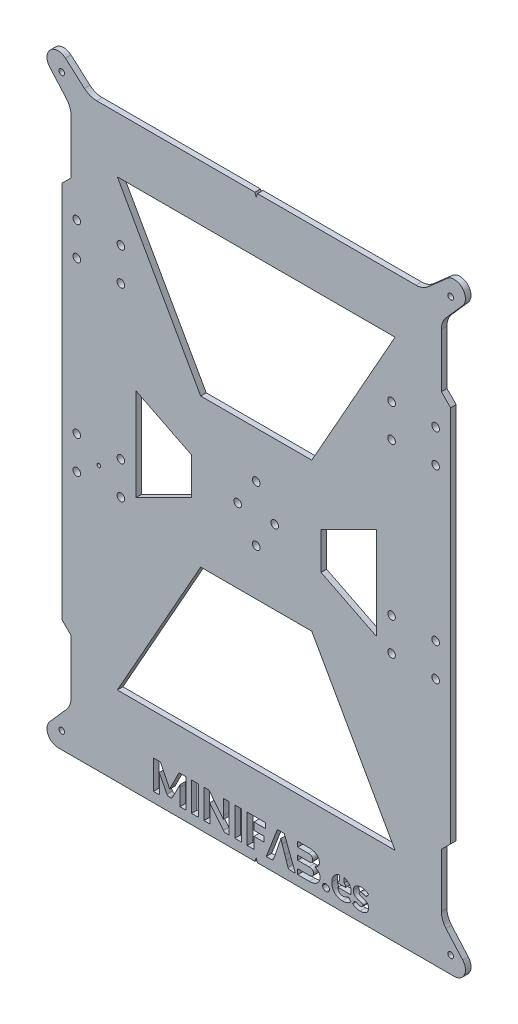
from build123d import *

# Parameters (mm, degrees)
MODEL_R                 = 2.05
MODEL_R_2               = 1.55
MODEL_R_3               = 1
MODEL_W                 = 3.629865987
MODEL_H                 = 15.619236111
MODEL_W_2               = 3.629865988
SALIENTE_EXTRUIR1_DEPTH = 3


with BuildPart() as part:
    # Model → Saliente-Extruir1 (new body)
    with BuildSketch(Plane.XY):
        with BuildLine():
            Line((-102.502115315, -142.835304077), (-111.498730811, -153.029934372))
            ThreePointArc((-111.498730811, -153.029934372), (-112.469021565, -159.467752645), (-107, -163))
            Line((-107, -163), (-0.700702433, -163))
            Line((-0.700702433, -163), (0, -160.996661892))
            Line((0, -160.996661892), (0.699463472, -163))
            Line((0.699463472, -163), (107, -163))
            ThreePointArc((107, -163), (112.469021565, -159.467752645), (111.498730811, -153.029934372))
            Line((111.498730811, -153.029934372), (102.502115315, -142.835304077))
            ThreePointArc((102.502115315, -142.835304077), (100.646421892, -139.755557374), (100, -136.21852803))
            Line((100, -136.21852803), (100, -107))
            Line((100, -107), (105, -102))
            Line((105, -102), (105, 102))
            Line((105, 102), (100, 107))
            Line((100, 107), (100, 136.21852803))
            ThreePointArc((100, 136.21852803), (100.646421892, 139.755557374), (102.502115315, 142.835304077))
            Line((102.502115315, 142.835304077), (111.498730811, 153.029934372))
            ThreePointArc((111.498730811, 153.029934372), (111.242640687, 161.242640687), (103.029934372, 161.498730811))
            Line((103.029934372, 161.498730811), (92.835304077, 152.502115315))
            ThreePointArc((92.835304077, 152.502115315), (89.755557374, 150.646421892), (86.21852803, 150))
            Line((86.21852803, 150), (0.701283747, 150))
            Line((0.701283747, 150), (0, 148))
            Line((0, 148), (-0.697387345, 150))
            Line((-0.697387345, 150), (-86.21852803, 150))
            ThreePointArc((-86.21852803, 150), (-89.755557374, 150.646421892), (-92.835304077, 152.502115315))
            Line((-92.835304077, 152.502115315), (-103.029934372, 161.498730811))
            ThreePointArc((-103.029934372, 161.498730811), (-111.242640687, 161.242640687), (-111.498730811, 153.029934372))
            Line((-111.498730811, 153.029934372), (-102.502115315, 142.835304077))
            ThreePointArc((-102.502115315, 142.835304077), (-100.646421892, 139.755557374), (-100, 136.21852803))
            Line((-100, 136.21852803), (-100, 107))
            Line((-100, 107), (-105, 102))
            Line((-105, 102), (-105, -102))
            Line((-105, -102), (-100, -107))
            Line((-100, -107), (-100, -136.21852803))
            ThreePointArc((-100, -136.21852803), (-100.646421892, -139.755557374), (-102.502115315, -142.835304077))
        make_face()
        with Locations((-96.9, 88.9)):
            Circle(MODEL_R, mode=Mode.SUBTRACT)
        with Locations((-73.1, 88.9)):
            Circle(MODEL_R, mode=Mode.SUBTRACT)
        with Locations((-73.1, 71.1)):
            Circle(MODEL_R, mode=Mode.SUBTRACT)
        with Locations((-96.9, 71.1)):
            Circle(MODEL_R, mode=Mode.SUBTRACT)
        with Locations((73.1, 88.9)):
            Circle(MODEL_R, mode=Mode.SUBTRACT)
        with Locations((96.9, 88.9)):
            Circle(MODEL_R, mode=Mode.SUBTRACT)
        with Locations((96.9, 71.1)):
            Circle(MODEL_R, mode=Mode.SUBTRACT)
        with Locations((73.1, 71.1)):
            Circle(MODEL_R, mode=Mode.SUBTRACT)
        with Locations((73.1, -11.095834068)):
            Circle(MODEL_R, mode=Mode.SUBTRACT)
        with Locations((96.9, -11.095834068)):
            Circle(MODEL_R, mode=Mode.SUBTRACT)
        with Locations((96.9, -28.895834068)):
            Circle(MODEL_R, mode=Mode.SUBTRACT)
        with Locations((73.1, -28.895834068)):
            Circle(MODEL_R, mode=Mode.SUBTRACT)
        with Locations((-96.9, -11.095834068)):
            Circle(MODEL_R, mode=Mode.SUBTRACT)
        with Locations((-73.1, -11.095834068)):
            Circle(MODEL_R, mode=Mode.SUBTRACT)
        with Locations((-73.1, -28.895834068)):
            Circle(MODEL_R, mode=Mode.SUBTRACT)
        with Locations((-96.9, -28.895834068)):
            Circle(MODEL_R, mode=Mode.SUBTRACT)
        with Locations((-10, 0)):
            Circle(MODEL_R, mode=Mode.SUBTRACT)
        with Locations((0, -15)):
            Circle(MODEL_R, mode=Mode.SUBTRACT)
        with Locations((10, 0)):
            Circle(MODEL_R, mode=Mode.SUBTRACT)
        with Locations((0, 15)):
            Circle(MODEL_R, mode=Mode.SUBTRACT)
        with Locations((-105, 154)):
            Circle(MODEL_R_2, mode=Mode.SUBTRACT)
        with Locations((105, 154)):
            Circle(MODEL_R_2, mode=Mode.SUBTRACT)
        with Locations((105, -154)):
            Circle(MODEL_R_2, mode=Mode.SUBTRACT)
        with Locations((-105, -154)):
            Circle(MODEL_R_2, mode=Mode.SUBTRACT)
        with Locations((-85, -19.995834068)):
            Circle(MODEL_R_3, mode=Mode.SUBTRACT)
        with BuildLine():
            Line((52.095027022, -156.41208278), (52.861160439, -155.160937482))
            add(Edge.make_bspline(
                [(52.861160439, -155.160937482), (52.907509966, -155.092418808), (52.997477945, -154.959418821), (53.185963701, -154.803141359), (53.423267883, -154.700400467), (53.600365736, -154.692510271), (53.695257304, -154.688282592)],
                knots=[0, 0, 0, 0, 0.245290843, 0.476128294, 0.719302032, 1, 1, 1, 1], degree=3))
            add(Edge.make_bspline(
                [(53.695257304, -154.688282592), (53.787088352, -154.693043404), (53.966912235, -154.702366044), (54.21796444, -154.812878477), (54.456999334, -154.950937893), (54.715280368, -155.097827414), (55.009108198, -155.236317332), (55.280571829, -155.349141253), (55.528920408, -155.422099819), (55.744003449, -155.462405293), (55.983002658, -155.481896061), (56.150151944, -155.486162753), (56.237708119, -155.488397733)],
                knots=[0, 0, 0, 0, 0.101218808, 0.198207026, 0.299998441, 0.408449622, 0.527553892, 0.660405958, 0.734188953, 0.814433565, 0.902796551, 1, 1, 1, 1], degree=3))
            add(Edge.make_bspline(
                [(56.237708119, -155.488397733), (56.356410443, -155.485846588), (56.574977321, -155.48114916), (56.876071404, -155.423093263), (57.119240443, -155.327949342), (57.314137005, -155.20601289), (57.454197585, -155.054947272), (57.552257465, -154.890093726), (57.614333338, -154.716297931), (57.621334472, -154.596079138), (57.624780313, -154.536909457)],
                knots=[0, 0, 0, 0, 0.188682589, 0.347421708, 0.484947511, 0.602199732, 0.710004379, 0.8091973, 0.9060901, 1, 1, 1, 1], degree=3))
            add(Edge.make_bspline(
                [(57.624780313, -154.536909457), (57.621482629, -154.484157312), (57.615108815, -154.382197149), (57.575117823, -154.235725982), (57.50199102, -154.106103883), (57.36128645, -153.954441298), (57.13562643, -153.783211356), (56.800832225, -153.624284121), (56.41224281, -153.476310395), (55.976542587, -153.345061986), (55.51175766, -153.205847702), (55.035193229, -153.048988326), (54.559828883, -152.859086985), (54.090517884, -152.646518294), (53.64711444, -152.380507075), (53.320740417, -152.099722678), (53.087751731, -151.845054324), (52.933308839, -151.629338826), (52.794807748, -151.394758141), (52.671669381, -151.139901752), (52.576657444, -150.858716387), (52.504524301, -150.551822021), (52.466347114, -150.216001771), (52.459841643, -149.983443484), (52.456468997, -149.862877765)],
                knots=[0, 0, 0, 0, 0.020826651, 0.040254073, 0.059360004, 0.078935649, 0.121531971, 0.17024273, 0.224661673, 0.28558902, 0.34974246, 0.416187632, 0.483507056, 0.551689521, 0.619371103, 0.686816769, 0.72077146, 0.75540288, 0.791298975, 0.828202462, 0.866889025, 0.90819589, 0.952405787, 1, 1, 1, 1], degree=3))
            add(Edge.make_bspline(
                [(52.456468997, -149.862877765), (52.460492112, -149.747397021), (52.468431386, -149.519505647), (52.517957846, -149.181333208), (52.606596919, -148.854291935), (52.722084904, -148.533616648), (52.87816878, -148.22942513), (53.06246008, -147.938356159), (53.288664772, -147.673586603), (53.542331366, -147.422896425), (53.835393057, -147.19868684), (54.160313751, -146.992243233), (54.523763196, -146.818917084), (54.918629928, -146.665986746), (55.348029509, -146.541592128), (55.813884728, -146.457614372), (56.312660992, -146.404031895), (56.656670418, -146.397182195), (56.833932915, -146.393652655)],
                knots=[0, 0, 0, 0, 0.055262239, 0.109055304, 0.163073539, 0.217165875, 0.271811873, 0.326342247, 0.381604486, 0.438048939, 0.496689275, 0.557794795, 0.621918591, 0.688988214, 0.760253721, 0.835436254, 0.915202962, 1, 1, 1, 1], degree=3))
            add(Edge.make_bspline(
                [(56.833932915, -146.393652655), (57.030965746, -146.398622916), (57.41963035, -146.408427191), (57.98868694, -146.497166197), (58.531706757, -146.622676315), (59.038931463, -146.801586748), (59.510543472, -147.011870326), (59.936196139, -147.264765225), (60.322963817, -147.538804587), (60.546381409, -147.751261153), (60.655332256, -147.854866793)],
                knots=[0, 0, 0, 0, 0.140830454, 0.277800468, 0.411066954, 0.538943015, 0.661888089, 0.779742, 0.892589946, 1, 1, 1, 1], degree=3))
            Line((60.655332256, -147.854866793), (59.907734325, -149.022602404))
            add(Edge.make_bspline(
                [(59.907734325, -149.022602404), (59.867180961, -149.082374658), (59.79206122, -149.193094846), (59.644245507, -149.321032103), (59.46367139, -149.386117508), (59.336740945, -149.392797444), (59.268260062, -149.39640137)],
                knots=[0, 0, 0, 0, 0.27702591, 0.513153834, 0.737339174, 1, 1, 1, 1], degree=3))
            add(Edge.make_bspline(
                [(59.268260062, -149.39640137), (59.189341546, -149.391713052), (59.028117745, -149.382135218), (58.790844894, -149.298353294), (58.549238458, -149.188947778), (58.284662805, -149.076643302), (57.99368379, -148.963533836), (57.668305918, -148.860810087), (57.300403204, -148.775870901), (57.037358104, -148.769533095), (56.898807116, -148.766194849)],
                knots=[0, 0, 0, 0, 0.095523231, 0.195145821, 0.302651249, 0.418035853, 0.543855996, 0.681433164, 0.832204629, 1, 1, 1, 1], degree=3))
            add(Edge.make_bspline(
                [(56.898807116, -148.766194849), (56.799810412, -148.769154533), (56.613115617, -148.774736108), (56.349099043, -148.815990719), (56.122215307, -148.892374014), (55.931437996, -148.998298896), (55.780422106, -149.13162692), (55.670438268, -149.291262798), (55.607259783, -149.476354571), (55.5992676, -149.607024102), (55.595144608, -149.674433658)],
                knots=[0, 0, 0, 0, 0.166013321, 0.313079344, 0.446335679, 0.565433653, 0.676725774, 0.78114646, 0.887098241, 1, 1, 1, 1], degree=3))
            add(Edge.make_bspline(
                [(55.595144608, -149.674433658), (55.59664219, -149.724315156), (55.599545797, -149.821028595), (55.647883369, -149.957403382), (55.714180504, -150.08366501), (55.852625747, -150.232828963), (56.079284207, -150.394278729), (56.408807229, -150.558858631), (56.795198378, -150.704599718), (57.227653587, -150.843228366), (57.687723387, -150.985880589), (58.160267565, -151.14975483), (58.634346501, -151.331217455), (59.096721773, -151.545188159), (59.535139284, -151.796165194), (59.860404016, -152.057503293), (60.095157385, -152.291393519), (60.247312763, -152.491289616), (60.389023172, -152.703770786), (60.505495027, -152.937585214), (60.605016239, -153.19071011), (60.669161948, -153.469694604), (60.715720213, -153.771283031), (60.718676728, -153.980643477), (60.720206457, -154.088968548)],
                knots=[0, 0, 0, 0, 0.020281241, 0.039322567, 0.058544603, 0.078231425, 0.12185398, 0.171570131, 0.228495125, 0.290544934, 0.357261034, 0.425439985, 0.495031948, 0.56473083, 0.633623771, 0.701027274, 0.734673084, 0.768870308, 0.803556567, 0.838958708, 0.875477567, 0.914489313, 0.955755964, 1, 1, 1, 1], degree=3))
            add(Edge.make_bspline(
                [(60.720206457, -154.088968548), (60.71660975, -154.223003344), (60.709495357, -154.488128164), (60.654060247, -154.877992372), (60.556229095, -155.250759141), (60.42719847, -155.607633647), (60.26184975, -155.945060467), (60.0533761, -156.257086475), (59.813629618, -156.548492525), (59.533179574, -156.812878296), (59.215436996, -157.045717595), (58.8678642, -157.260638899), (58.479324457, -157.434925338), (58.062028595, -157.592781481), (57.609379799, -157.711274008), (57.123933207, -157.797612873), (56.605450373, -157.850252979), (56.248130024, -157.8573149), (56.06471025, -157.860939927)],
                knots=[0, 0, 0, 0, 0.059485075, 0.117663251, 0.174314871, 0.230276316, 0.28587819, 0.340645236, 0.396477726, 0.453062923, 0.511205175, 0.571096297, 0.63408369, 0.699887322, 0.768962516, 0.841408182, 0.918591607, 1, 1, 1, 1], degree=3))
            add(Edge.make_bspline(
                [(56.06471025, -157.860939927), (55.87595853, -157.855588608), (55.496642064, -157.84483457), (54.932274669, -157.757376771), (54.378424414, -157.62417346), (53.841501884, -157.452896095), (53.333935545, -157.240930649), (52.867005735, -156.996278733), (52.449602472, -156.72532334), (52.210173144, -156.513805659), (52.095027022, -156.41208278)],
                knots=[0, 0, 0, 0, 0.131193657, 0.263647474, 0.396161276, 0.527045832, 0.655106904, 0.778099117, 0.893283641, 1, 1, 1, 1], degree=3))
        make_face(mode=Mode.SUBTRACT)
        with BuildLine():
            Line((5.407227309, -157.663228077), (11.428170976, -142.043991966))
            Line((11.428170976, -142.043991966), (15.122911164, -142.043991966))
            Line((15.122911164, -142.043991966), (21.143854831, -157.663228077))
            Line((21.143854831, -157.663228077), (18.348085709, -157.663228077))
            add(Edge.make_bspline(
                [(18.348085709, -157.663228077), (18.273802919, -157.659905766), (18.131295521, -157.653532097), (17.926826548, -157.615032697), (17.746081904, -157.542162091), (17.585016004, -157.446415564), (17.451247247, -157.323229604), (17.330281041, -157.189586871), (17.231446631, -157.036283556), (17.179118243, -156.925530006), (17.152546869, -156.869291432)],
                knots=[0, 0, 0, 0, 0.145623833, 0.279371219, 0.40526303, 0.525684031, 0.644316883, 0.760101574, 0.878184081, 1, 1, 1, 1], degree=3))
            Line((17.152546869, -156.869291432), (16.235040318, -154.104414786))
            Line((16.235040318, -154.104414786), (15.410211195, -151.731872592))
            Line((15.410211195, -151.731872592), (13.970621791, -147.459443094))
            add(Edge.make_bspline(
                [(13.970621791, -147.459443094), (13.91412571, -147.312516209), (13.79275931, -146.996883923), (13.61900629, -146.486756998), (13.442433037, -145.9163441), (13.326394472, -145.5164943), (13.266273327, -145.309326731)],
                knots=[0, 0, 0, 0, 0.208625136, 0.448174127, 0.71409158, 1, 1, 1, 1], degree=3))
            add(Edge.make_bspline(
                [(13.266273327, -145.309326731), (13.212132749, -145.518770101), (13.107112331, -145.925042641), (12.932615886, -146.501650641), (12.758647453, -147.016152135), (12.63890292, -147.334094992), (12.583549597, -147.481067828)],
                knots=[0, 0, 0, 0, 0.284872901, 0.552588689, 0.793178843, 1, 1, 1, 1], degree=3))
            Line((12.583549597, -147.481067828), (11.150138688, -151.731872592))
            Line((11.150138688, -151.731872592), (10.319131071, -154.104414786))
            Line((10.319131071, -154.104414786), (9.401624519, -156.869291432))
            add(Edge.make_bspline(
                [(9.401624519, -156.869291432), (9.37942601, -156.919523008), (9.334671429, -157.020795265), (9.237737403, -157.161826221), (9.121088909, -157.298149705), (8.97978026, -157.422465172), (8.821379346, -157.534234184), (8.637865983, -157.606091367), (8.439394776, -157.65584927), (8.300135424, -157.660703516), (8.227710413, -157.663228077)],
                knots=[0, 0, 0, 0, 0.10919095, 0.220140691, 0.339408079, 0.465818727, 0.594407891, 0.723176935, 0.856031833, 1, 1, 1, 1], degree=3))
            Line((8.227710413, -157.663228077), (5.407227309, -157.663228077))
        make_face(mode=Mode.SUBTRACT)
        with Locations((-9.777969507, -149.853610022)):
            Rectangle(MODEL_W, MODEL_H, mode=Mode.SUBTRACT)
        with Locations((-33.107967749, -149.853610022)):
            Rectangle(MODEL_W_2, MODEL_H, mode=Mode.SUBTRACT)
        Polygon((30, -40), (-30, -40), (-75, -120), (75, -120), align=None, mode=Mode.SUBTRACT)
        Polygon((30, 40), (75, 120), (-75, 120), (-30, 40), align=None, mode=Mode.SUBTRACT)
        Polygon((-35, 10), (-65, 25), (-65, -25), (-35, -10), align=None, mode=Mode.SUBTRACT)
        Polygon((35, -10), (65, -25), (65, 25), (35, 10), align=None, mode=Mode.SUBTRACT)
        with BuildLine():
            Line((-45.939157857, -150.493084285), (-41.944760648, -142.581521057))
            add(Edge.make_bspline(
                [(-41.944760648, -142.581521057), (-41.910568452, -142.519613053), (-41.848741672, -142.40767018), (-41.736257155, -142.266107247), (-41.613542672, -142.164776553), (-41.477670089, -142.094285522), (-41.326818737, -142.048823987), (-41.153859986, -142.04242163), (-40.960383107, -142.044470912), (-40.822355721, -142.044157845), (-40.749221808, -142.043991966)],
                knots=[0, 0, 0, 0, 0.149113897, 0.269629725, 0.379286647, 0.482346688, 0.591029824, 0.708729195, 0.845669947, 1, 1, 1, 1], degree=3))
            Line((-40.749221808, -142.043991966), (-37.996702153, -142.043991966))
            Line((-37.996702153, -142.043991966), (-37.996702153, -157.663228077))
            Line((-37.996702153, -157.663228077), (-41.178627231, -157.663228077))
            Line((-41.178627231, -157.663228077), (-41.178627231, -148.692052906))
            add(Edge.make_bspline(
                [(-41.178627231, -148.692052906), (-41.178147621, -148.583919941), (-41.17715156, -148.359347704), (-41.164598993, -148.012139819), (-41.140892133, -147.649382829), (-41.114609977, -147.403759369), (-41.10139604, -147.28026673)],
                knots=[0, 0, 0, 0, 0.229296752, 0.476207091, 0.736651504, 1, 1, 1, 1], degree=3))
            Line((-41.10139604, -147.28026673), (-45.234809393, -155.296864379))
            add(Edge.make_bspline(
                [(-45.234809393, -155.296864379), (-45.268141272, -155.356659066), (-45.332924596, -155.472875098), (-45.457184522, -155.626702595), (-45.59508224, -155.760332411), (-45.750955237, -155.868740274), (-45.919409942, -155.953581848), (-46.101013303, -156.011255564), (-46.293787529, -156.050408132), (-46.427056685, -156.054649755), (-46.495222434, -156.0568193)],
                knots=[0, 0, 0, 0, 0.131962136, 0.256479574, 0.380232703, 0.501582629, 0.621622397, 0.742972324, 0.86853309, 1, 1, 1, 1], degree=3))
            Line((-46.495222434, -156.0568193), (-46.98641281, -156.0568193))
            add(Edge.make_bspline(
                [(-46.98641281, -156.0568193), (-47.054606808, -156.054772453), (-47.186918934, -156.050801098), (-47.379296414, -156.010202488), (-47.561497797, -155.954401537), (-47.730460039, -155.868462421), (-47.886685107, -155.761504054), (-48.021085399, -155.624569744), (-48.149190452, -155.474118468), (-48.213763181, -155.356888647), (-48.246825851, -155.296864379)],
                knots=[0, 0, 0, 0, 0.131498788, 0.255138056, 0.378408896, 0.498477771, 0.619857123, 0.742210121, 0.868005866, 1, 1, 1, 1], degree=3))
            Line((-48.246825851, -155.296864379), (-52.377149957, -147.258641997))
            add(Edge.make_bspline(
                [(-52.377149957, -147.258641997), (-52.367809182, -147.386325129), (-52.349357684, -147.638546707), (-52.323585162, -148.008057904), (-52.307696735, -148.358280396), (-52.30452709, -148.583915561), (-52.303008013, -148.692052906)],
                knots=[0, 0, 0, 0, 0.267529806, 0.528470663, 0.774016027, 1, 1, 1, 1], degree=3))
            Line((-52.303008013, -148.692052906), (-52.303008013, -157.663228077))
            Line((-52.303008013, -157.663228077), (-55.484933091, -157.663228077))
            Line((-55.484933091, -157.663228077), (-55.484933091, -142.043991966))
            Line((-55.484933091, -142.043991966), (-52.729324189, -142.043991966))
            add(Edge.make_bspline(
                [(-52.729324189, -142.043991966), (-52.656185814, -142.044150471), (-52.519180127, -142.04444739), (-52.326783475, -142.042517263), (-52.154685828, -142.048613602), (-52.003522356, -142.095271335), (-51.865594773, -142.162713743), (-51.745514635, -142.268358315), (-51.629172567, -142.406221618), (-51.567640694, -142.519302836), (-51.533785349, -142.581521057)],
                knots=[0, 0, 0, 0, 0.15441206, 0.28925076, 0.407012673, 0.51575356, 0.620799734, 0.728842438, 0.850806869, 1, 1, 1, 1], degree=3))
            Line((-51.533785349, -142.581521057), (-47.530120396, -150.527066009))
            add(Edge.make_bspline(
                [(-47.530120396, -150.527066009), (-47.459064677, -150.665579392), (-47.315451528, -150.945533539), (-47.117121165, -151.378848043), (-46.920789213, -151.822665772), (-46.800098525, -152.125864), (-46.739272998, -152.278669426)],
                knots=[0, 0, 0, 0, 0.242868269, 0.490869384, 0.743409054, 1, 1, 1, 1], degree=3))
            add(Edge.make_bspline(
                [(-46.739272998, -152.278669426), (-46.677997895, -152.122970701), (-46.556210219, -151.813510828), (-46.366039385, -151.356774145), (-46.165017364, -150.914650091), (-46.013783106, -150.632371993), (-45.939157857, -150.493084285)],
                knots=[0, 0, 0, 0, 0.256340499, 0.509490997, 0.757962538, 1, 1, 1, 1], degree=3))
        make_face(mode=Mode.SUBTRACT)
        with BuildLine():
            Line((-25.102182468, -142.596967295), (-17.70343435, -151.938852185))
            add(Edge.make_bspline(
                [(-17.70343435, -151.938852185), (-17.719855579, -151.791693543), (-17.752078725, -151.502926229), (-17.782926468, -151.076318222), (-17.797469253, -150.668247583), (-17.80071715, -150.402475074), (-17.802290274, -150.273747702)],
                knots=[0, 0, 0, 0, 0.266141359, 0.522245416, 0.768598745, 1, 1, 1, 1], degree=3))
            Line((-17.802290274, -150.273747702), (-17.802290274, -142.043991966))
            Line((-17.802290274, -142.043991966), (-14.620365196, -142.043991966))
            Line((-14.620365196, -142.043991966), (-14.620365196, -157.663228077))
            Line((-14.620365196, -157.663228077), (-16.498627767, -157.663228077))
            add(Edge.make_bspline(
                [(-16.498627767, -157.663228077), (-16.565649281, -157.66140957), (-16.693997119, -157.657927084), (-16.878157439, -157.632680028), (-17.046536993, -157.593548955), (-17.201568578, -157.535065792), (-17.343934951, -157.448980795), (-17.487885219, -157.348577115), (-17.626350343, -157.216113935), (-17.713521973, -157.116125488), (-17.759040807, -157.063914033)],
                knots=[0, 0, 0, 0, 0.138411685, 0.265061759, 0.383209361, 0.495000959, 0.605551181, 0.725974709, 0.856910878, 1, 1, 1, 1], degree=3))
            Line((-17.759040807, -157.063914033), (-25.092914725, -147.786903345))
            add(Edge.make_bspline(
                [(-25.092914725, -147.786903345), (-25.079392948, -147.923772473), (-25.052891013, -148.192028398), (-25.033712615, -148.586871647), (-25.019980055, -148.962775223), (-25.019167135, -149.206914784), (-25.018772781, -149.325348674)],
                knots=[0, 0, 0, 0, 0.267722284, 0.524720875, 0.769438614, 1, 1, 1, 1], degree=3))
            Line((-25.018772781, -149.325348674), (-25.018772781, -157.663228077))
            Line((-25.018772781, -157.663228077), (-28.200697859, -157.663228077))
            Line((-28.200697859, -157.663228077), (-28.200697859, -142.043991966))
            Line((-28.200697859, -142.043991966), (-26.300810555, -142.043991966))
            add(Edge.make_bspline(
                [(-26.300810555, -142.043991966), (-26.228684803, -142.04520166), (-26.096600531, -142.04741698), (-25.913809582, -142.062364252), (-25.755810273, -142.08793979), (-25.616319894, -142.13954361), (-25.486548849, -142.211889066), (-25.362572728, -142.313097331), (-25.234788105, -142.443635374), (-25.148954124, -142.542885221), (-25.102182468, -142.596967295)],
                knots=[0, 0, 0, 0, 0.155923451, 0.285543443, 0.396470398, 0.500715698, 0.605388137, 0.716315093, 0.845417714, 1, 1, 1, 1], degree=3))
        make_face(mode=Mode.SUBTRACT)
        Polygon((-4.870699617, -142.043991966), (5.144641259, -142.043991966), (5.144641259, -144.811957859), (-1.24083363, -144.811957859), (-1.24083363, -148.766194849), (4.075761573, -148.766194849), (4.075761573, -151.534160743), (-1.24083363, -151.534160743), (-1.24083363, -157.663228077), (-4.870699617, -157.663228077), align=None, mode=Mode.SUBTRACT)
        with BuildLine():
            Line((28.629101884, -157.663228077), (22.413535615, -157.663228077))
            Line((22.413535615, -157.663228077), (22.413535615, -154.895262184))
            Line((22.413535615, -154.895262184), (28.564227683, -154.895262184))
            add(Edge.make_bspline(
                [(28.564227683, -154.895262184), (28.678612063, -154.892821654), (28.896599758, -154.888170621), (29.207025929, -154.855369515), (29.483660414, -154.797670384), (29.728385602, -154.71569281), (29.945414611, -154.618091568), (30.135354911, -154.50138465), (30.303524613, -154.376785303), (30.444583138, -154.235033238), (30.561710383, -154.082214096), (30.663074209, -153.921047518), (30.738682358, -153.747346422), (30.817248535, -153.506792473), (30.874369174, -153.194683421), (30.885090338, -152.942049787), (30.890431162, -152.816198517)],
                knots=[0, 0, 0, 0, 0.096124144, 0.183188304, 0.261946419, 0.333100703, 0.399710058, 0.461452896, 0.520129498, 0.575204588, 0.628867703, 0.681708049, 0.734781749, 0.78760083, 0.894191819, 1, 1, 1, 1], degree=3))
            add(Edge.make_bspline(
                [(30.890431162, -152.816198517), (30.88573823, -152.676722485), (30.876812817, -152.411455271), (30.805056422, -152.092574101), (30.718784569, -151.863409121), (30.631564656, -151.708898615), (30.524947747, -151.567217365), (30.396652109, -151.439856402), (30.248184845, -151.325819028), (30.077252178, -151.224855043), (29.883989698, -151.140207177), (29.667535821, -151.069387436), (29.427546613, -151.008803106), (29.158302871, -150.971557235), (28.860249801, -150.94621438), (28.651818648, -150.942809378), (28.542602949, -150.941025194)],
                knots=[0, 0, 0, 0, 0.120625255, 0.229415228, 0.281070801, 0.332161647, 0.382444898, 0.434138926, 0.488171043, 0.544132579, 0.60559723, 0.670441164, 0.741148885, 0.819574129, 0.90545877, 1, 1, 1, 1], degree=3))
            Line((28.542602949, -150.941025194), (22.413535615, -150.941025194))
            Line((22.413535615, -150.941025194), (22.413535615, -148.568483))
            Line((22.413535615, -148.568483), (27.903128686, -148.568483))
            add(Edge.make_bspline(
                [(27.903128686, -148.568483), (28.092763094, -148.564450011), (28.452548606, -148.556798388), (28.889198619, -148.505651282), (29.206194546, -148.440260689), (29.421073837, -148.374680234), (29.618504067, -148.295911561), (29.797398747, -148.199297424), (29.957580225, -148.084288373), (30.09596227, -147.947976753), (30.216076799, -147.793562882), (30.315601665, -147.619153237), (30.392989376, -147.421489494), (30.448411923, -147.201553352), (30.477725646, -146.957705481), (30.482988969, -146.788118702), (30.48573972, -146.699488173)],
                knots=[0, 0, 0, 0, 0.154690544, 0.293487964, 0.357913417, 0.418505665, 0.476539612, 0.531049205, 0.583982283, 0.636855327, 0.68894841, 0.743133345, 0.800074646, 0.861608874, 0.927673142, 1, 1, 1, 1], degree=3))
            add(Edge.make_bspline(
                [(30.48573972, -146.699488173), (30.483855074, -146.61292801), (30.480256942, -146.447668995), (30.456128796, -146.21086767), (30.414032795, -145.996171793), (30.350816611, -145.803256885), (30.275269877, -145.626713199), (30.174365922, -145.472718801), (30.05978629, -145.33284104), (29.921042286, -145.215682548), (29.765415644, -145.113241378), (29.591641392, -145.025875805), (29.396705587, -144.959021839), (29.183804283, -144.904219881), (28.951747454, -144.860174104), (28.69851807, -144.834788023), (28.425523992, -144.814935057), (28.235780141, -144.812970939), (28.137911508, -144.811957859)],
                knots=[0, 0, 0, 0, 0.074122968, 0.141514161, 0.203601947, 0.261051203, 0.31513266, 0.367482417, 0.418179439, 0.469448465, 0.52227881, 0.577491608, 0.635506614, 0.698390909, 0.765672386, 0.83754214, 0.916205301, 1, 1, 1, 1], degree=3))
            Line((28.137911508, -144.811957859), (22.413535615, -144.811957859))
            Line((22.413535615, -144.811957859), (22.413535615, -142.043991966))
            Line((22.413535615, -142.043991966), (28.137911508, -142.043991966))
            add(Edge.make_bspline(
                [(28.137911508, -142.043991966), (28.396469499, -142.047389312), (28.894663129, -142.053935373), (29.612038344, -142.108075493), (30.269191697, -142.203959242), (30.868476106, -142.332169694), (31.411095605, -142.495218557), (31.900281118, -142.690342174), (32.338445662, -142.914664775), (32.725456228, -143.172456181), (33.061685744, -143.460946258), (33.349406032, -143.779493665), (33.589897148, -144.126190698), (33.7748863, -144.504891147), (33.916008958, -144.906892693), (34.023272479, -145.330287387), (34.080330743, -145.779398748), (34.089360931, -146.08561336), (34.093980974, -146.242279521)],
                knots=[0, 0, 0, 0, 0.093616039, 0.180380865, 0.260269038, 0.333916395, 0.402094773, 0.465171933, 0.524374279, 0.580011296, 0.633153496, 0.684370648, 0.735048851, 0.785407818, 0.836474093, 0.88910631, 0.943264338, 1, 1, 1, 1], degree=3))
            add(Edge.make_bspline(
                [(34.093980974, -146.242279521), (34.087386466, -146.412900288), (34.074245818, -146.752890416), (33.9722185, -147.16645151), (33.863409868, -147.487127066), (33.753481222, -147.717225893), (33.626986836, -147.943071077), (33.474284142, -148.157036869), (33.305631693, -148.367156951), (33.106225688, -148.560370631), (32.89270321, -148.754194138), (32.649174854, -148.931103642), (32.387628777, -149.1037171), (32.095625116, -149.256097382), (31.783376488, -149.406732424), (31.560519422, -149.48981797), (31.446495739, -149.532328266)],
                knots=[0, 0, 0, 0, 0.112811763, 0.224796115, 0.280437357, 0.336875174, 0.39337475, 0.45164087, 0.510750809, 0.571505591, 0.635270243, 0.70155213, 0.770589916, 0.842591637, 0.919462813, 1, 1, 1, 1], degree=3))
            add(Edge.make_bspline(
                [(31.446495739, -149.532328266), (31.570351481, -149.565258273), (31.812538198, -149.629649394), (32.161927128, -149.741460429), (32.483631553, -149.876085855), (32.78101629, -150.020999742), (33.055789913, -150.177785399), (33.302139205, -150.353855191), (33.524002656, -150.544473747), (33.723176477, -150.747935488), (33.895494154, -150.969170191), (34.050118148, -151.201781151), (34.17538278, -151.452486415), (34.278623455, -151.718356144), (34.358036281, -151.999880246), (34.41705011, -152.296196298), (34.451072392, -152.60842877), (34.45598887, -152.821264944), (34.458512196, -152.93050068)],
                knots=[0, 0, 0, 0, 0.077328582, 0.15120781, 0.221132565, 0.287546079, 0.350742664, 0.411776337, 0.469937085, 0.527059703, 0.583245346, 0.638909798, 0.695318312, 0.751972676, 0.810777052, 0.871582585, 0.934091228, 1, 1, 1, 1], degree=3))
            add(Edge.make_bspline(
                [(34.458512196, -152.93050068), (34.453587661, -153.094478888), (34.443846641, -153.41883742), (34.371574202, -153.896513455), (34.250698622, -154.357550185), (34.080156576, -154.798055858), (33.867535326, -155.218105083), (33.604793943, -155.609894591), (33.298847703, -155.975145291), (32.946965498, -156.30987832), (32.553953207, -156.614482436), (32.112960251, -156.880283132), (31.631500948, -157.114755731), (31.107347765, -157.312459718), (30.543056795, -157.470008968), (29.939572787, -157.583188423), (29.296970628, -157.65240885), (28.855826275, -157.659555226), (28.629101884, -157.663228077)],
                knots=[0, 0, 0, 0, 0.058312482, 0.115345515, 0.171405784, 0.227524656, 0.283057137, 0.33852435, 0.394942454, 0.452196183, 0.510953314, 0.571447506, 0.635007695, 0.701199393, 0.770430535, 0.843129867, 0.919377217, 1, 1, 1, 1], degree=3))
        make_face(mode=Mode.SUBTRACT)
        with BuildLine():
            Line((44.171106804, -150.743313344), (48.292163167, -150.743313344))
            add(Edge.make_bspline(
                [(48.292163167, -150.743313344), (48.287605297, -150.620369175), (48.278512687, -150.375104702), (48.199573604, -150.017192621), (48.069979469, -149.678353497), (47.901453324, -149.428284272), (47.738542777, -149.250302693), (47.615329918, -149.150780349), (47.535434752, -149.094702367), (47.505310724, -149.074884231)],
                knots=[0, 0, 0, 0, 0.117376165, 0.234156717, 0.348557676, 0.462104615, 0.51990096, 0.578619977, 0.613071392, 0.613071392, 0.613071392, 0.613071392], degree=3))
            Line((47.505310724, -149.074884231), (47.505310724, -146.510761714))
            add(Edge.make_bspline(
                [(47.505310724, -146.510761714), (47.61392782, -146.532139601), (47.881406269, -146.592772081), (48.295043803, -146.728815483), (48.736433346, -146.918629496), (49.147918591, -147.148827597), (49.527162632, -147.417973027), (49.870884136, -147.730148358), (50.18497123, -148.076037359), (50.459731518, -148.461621728), (50.700493401, -148.882171464), (50.898788361, -149.340952423), (51.065153171, -149.830561059), (51.176768994, -150.356270283), (51.250899335, -150.911090493), (51.257540755, -151.292945167), (51.260930157, -151.487822028)],
                knots=[0.152869262, 0.152869262, 0.152869262, 0.152869262, 0.194178123, 0.25521369, 0.315138416, 0.373319689, 0.430930325, 0.488371366, 0.546355404, 0.605038832, 0.664791873, 0.726939833, 0.791377729, 0.857517087, 0.927284842, 1, 1, 1, 1], degree=3))
            add(Edge.make_bspline(
                [(51.260930157, -151.487822028), (51.259317658, -151.601176543), (51.256410321, -151.80555478), (51.233044187, -152.080368967), (51.194808229, -152.300633458), (51.120623624, -152.469520149), (51.017535261, -152.597220742), (50.878254359, -152.678011586), (50.705804748, -152.71539597), (50.58145638, -152.718649433), (50.513332226, -152.72043184)],
                knots=[0, 0, 0, 0, 0.201813898, 0.363870538, 0.491197522, 0.597900432, 0.689011159, 0.77865181, 0.878734571, 1, 1, 1, 1], degree=3))
            Line((50.513332226, -152.72043184), (44.127857331, -152.72043184))
            add(Edge.make_bspline(
                [(44.127857331, -152.72043184), (44.142990578, -152.838024891), (44.172329343, -153.06600206), (44.236822743, -153.393266353), (44.318028353, -153.695375222), (44.411000654, -153.973825489), (44.527665709, -154.225913436), (44.655530396, -154.454837093), (44.801712277, -154.65902869), (44.967307771, -154.834547086), (45.144003629, -154.991505456), (45.335902442, -155.123374719), (45.538923208, -155.235556481), (45.752507405, -155.329299052), (45.980754871, -155.399915901), (46.220414897, -155.452202975), (46.47276874, -155.484046007), (46.644471038, -155.486927346), (46.732093099, -155.488397733)],
                knots=[0, 0, 0, 0, 0.083732127, 0.162331133, 0.235375943, 0.30461314, 0.369385244, 0.431275274, 0.489618702, 0.546231686, 0.601381946, 0.656262945, 0.710308537, 0.765035077, 0.820705702, 0.878771897, 0.93813562, 1, 1, 1, 1], degree=3))
            add(Edge.make_bspline(
                [(46.732093099, -155.488397733), (46.824868518, -155.486849255), (47.00468158, -155.483848067), (47.263526243, -155.454351616), (47.504513364, -155.414308641), (47.78989858, -155.325565044), (48.112827628, -155.199550439), (48.461319417, -155.026165692), (48.770892973, -154.851460076), (49.054416421, -154.689686886), (49.339293164, -154.567804038), (49.538030984, -154.553317432), (49.635985888, -154.5461772)],
                knots=[0, 0, 0, 0, 0.089916446, 0.174271932, 0.252418251, 0.326348982, 0.463564263, 0.588155024, 0.703469694, 0.808023536, 0.905377667, 1, 1, 1, 1], degree=3))
            add(Edge.make_bspline(
                [(49.635985888, -154.5461772), (49.698271889, -154.549377924), (49.81837531, -154.555549743), (49.984790268, -154.612788448), (50.130121612, -154.70523045), (50.199542905, -154.793955736), (50.235299932, -154.839655727)],
                knots=[0, 0, 0, 0, 0.268064691, 0.516897632, 0.751167059, 1, 1, 1, 1], degree=3))
            Line((50.235299932, -154.839655727), (51.196055951, -156.050640805))
            add(Edge.make_bspline(
                [(51.196055951, -156.050640805), (51.109557682, -156.140235361), (50.939473533, -156.316407833), (50.668929487, -156.560375184), (50.385975274, -156.775021669), (49.999814086, -157.024961828), (49.49984193, -157.283196464), (48.881749398, -157.521713692), (48.254920061, -157.686799576), (47.633334663, -157.794242187), (47.026585664, -157.848686406), (46.629207525, -157.856924619), (46.435525324, -157.860939927)],
                knots=[0, 0, 0, 0, 0.071191879, 0.139986735, 0.208049588, 0.274025419, 0.402798144, 0.52897666, 0.652083446, 0.772785997, 0.88925584, 1, 1, 1, 1], degree=3))
            add(Edge.make_bspline(
                [(46.435525324, -157.860939927), (46.243753524, -157.856179068), (45.866081741, -157.846803121), (45.309073912, -157.772762079), (44.769648152, -157.657237052), (44.250816985, -157.489254244), (43.754830444, -157.278735561), (43.293098535, -157.012677009), (42.860422975, -156.705820361), (42.460584237, -156.352774848), (42.096976403, -155.95251985), (41.776197469, -155.503938413), (41.489343496, -155.014209998), (41.249227909, -154.476567672), (41.051483672, -153.894478175), (40.92024377, -153.263662366), (40.833555748, -152.590004653), (40.82412809, -152.125527989), (40.819273099, -151.886334974)],
                knots=[0, 0, 0, 0, 0.062243544, 0.122581265, 0.182126446, 0.241124724, 0.299380376, 0.35673199, 0.413786585, 0.471343453, 0.529569356, 0.588956642, 0.650083944, 0.713530737, 0.779820753, 0.849266438, 0.922376262, 1, 1, 1, 1], degree=3))
            add(Edge.make_bspline(
                [(40.819273099, -151.886334974), (40.824198308, -151.70281479), (40.833975027, -151.338520485), (40.906744499, -150.800771492), (41.02475722, -150.277737624), (41.187878149, -149.771610867), (41.396060805, -149.287395996), (41.652698184, -148.833845475), (41.945324079, -148.409125967), (42.281035191, -148.017994267), (42.655847299, -147.662113723), (43.068136648, -147.342327304), (43.518806579, -147.063354721), (44.006066916, -146.825510431), (44.5041541, -146.636561432), (44.845837432, -146.552266299), (45.008326286, -146.518989665)],
                knots=[0, 0, 0, 0, 0.063477393, 0.126004956, 0.187367736, 0.248768769, 0.309721688, 0.369377107, 0.428770265, 0.487891414, 0.547361451, 0.607290691, 0.66808933, 0.730386087, 0.794640495, 0.851966423, 0.851966423, 0.851966423, 0.851966423], degree=3))
            Line((45.008326286, -146.518989665), (45.008326286, -149.162793479))
            add(Edge.make_bspline(
                [(45.008326286, -149.162793479), (44.962117829, -149.198198011), (44.822292683, -149.317109949), (44.619094239, -149.558198763), (44.419345014, -149.902459506), (44.263623524, -150.301587768), (44.202841762, -150.591793243), (44.171106804, -150.743313344)],
                knots=[0.437651286, 0.437651286, 0.437651286, 0.437651286, 0.491271306, 0.606533375, 0.726677217, 0.857294574, 1, 1, 1, 1], degree=3))
        make_face(mode=Mode.SUBTRACT)
        with BuildLine():
            add(Edge.make_bspline(
                [(37.696043732, -154.302126636), (37.824720195, -154.307450806), (38.076661824, -154.317875246), (38.43246123, -154.435394068), (38.756615242, -154.596045693), (39.03594658, -154.815286504), (39.270355074, -155.076429753), (39.43879355, -155.383220976), (39.554088648, -155.721438442), (39.567488166, -155.960096065), (39.574306302, -156.081533281)],
                knots=[0, 0, 0, 0, 0.13386395, 0.262098452, 0.387617048, 0.510222984, 0.630601785, 0.751445565, 0.873526945, 1, 1, 1, 1], degree=3))
            add(Edge.make_bspline(
                [(39.574306302, -156.081533281), (39.56725706, -156.202901622), (39.553289224, -156.443388906), (39.439634333, -156.785206725), (39.270137069, -157.095409522), (39.037921486, -157.360222657), (38.756052442, -157.575852557), (38.432876055, -157.735068211), (38.075544441, -157.843403365), (37.824541905, -157.855002082), (37.696043732, -157.860939927)],
                knots=[0, 0, 0, 0, 0.126215695, 0.250092155, 0.371626995, 0.492568156, 0.614268707, 0.739048287, 0.866408449, 1, 1, 1, 1], degree=3))
            add(Edge.make_bspline(
                [(37.696043732, -157.860939927), (37.565553155, -157.854888025), (37.310634972, -157.843065409), (36.949140528, -157.737120857), (36.626992893, -157.57537961), (36.347169923, -157.361394312), (36.123258914, -157.092293372), (35.947502136, -156.787020507), (35.840036288, -156.442586726), (35.825252028, -156.202736002), (35.817781162, -156.081533281)],
                knots=[0, 0, 0, 0, 0.135567217, 0.264835587, 0.388508155, 0.509214273, 0.628614129, 0.750527741, 0.87393527, 1, 1, 1, 1], degree=3))
            add(Edge.make_bspline(
                [(35.817781162, -156.081533281), (35.825027314, -155.960266446), (35.839249256, -155.722257413), (35.948367883, -155.381398822), (36.123009519, -155.079557996), (36.349136065, -154.814065932), (36.626441538, -154.596545126), (36.949507872, -154.433279356), (37.309537067, -154.318205645), (37.565378191, -154.307562434), (37.696043732, -154.302126636)],
                knots=[0, 0, 0, 0, 0.126323024, 0.247932758, 0.36916246, 0.487989433, 0.60960391, 0.734017613, 0.864155019, 1, 1, 1, 1], degree=3))
        make_face(mode=Mode.SUBTRACT)
    extrude(amount=SALIENTE_EXTRUIR1_DEPTH)


solid = part.part
